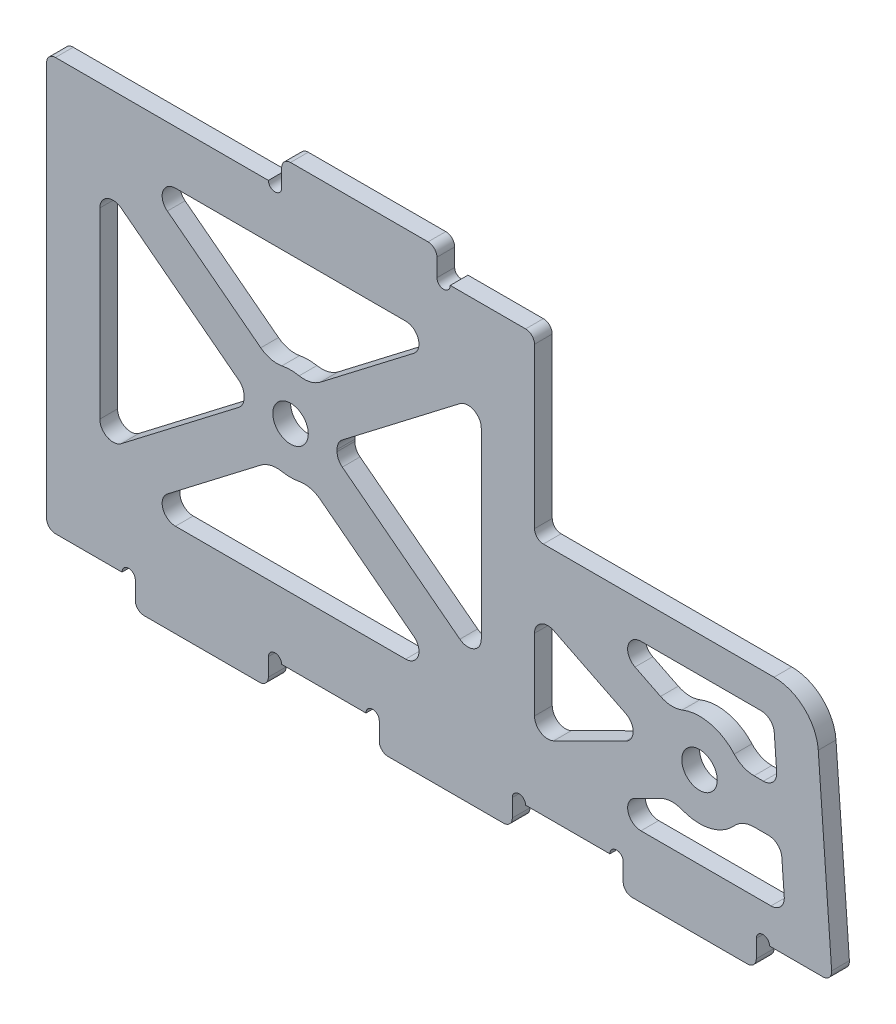
from build123d import *

# Parameters (mm, degrees)
EXTRUDE_1_DEPTH     = 2
SKETCH_2_R          = 0.75
SKETCH_2_W          = 43
SKETCH_2_H          = 33
CUT_EXTRUDE_1_DEPTH = 102.422384117
EXTRUDE_START       = -2
EXTRUDE_1_2_DEPTH   = 2
FILLET_1_R          = 1
SKETCH_4_R          = 2
CUT_EXTRUDE_2_DEPTH = 102.422384117
FILLET_2_R          = 3
FILLET_3_R          = 1.5


# Read off the part's stored shape, not the designer's step: 拉伸-薄壁1
with BuildPart() as part:
    # 草图1 → Extrude 1 (new body)
    with BuildSketch(Plane.XY):
        with BuildLine():
            Line((88.497370929, 1.072465371), (86.986854645, 21.862326856))
            ThreePointArc((86.986854645, 21.862326856), (85.405023181, 25.161395518), (82, 26.5))
            Line((82, 26.5), (55, 26.5))
            Line((55, 26.5), (55, 46.5))
            Line((55, 46.5), (44, 46.5))
            Line((44, 46.5), (44, 49.5))
            Line((44, 49.5), (26.5, 49.5))
            Line((26.5, 49.5), (26.5, 46.5))
            Line((26.5, 46.5), (0, 46.5))
            Line((0, 46.5), (0, 0))
            Line((0, 0), (10, 0))
            Line((10, 0), (10, -3))
            Line((10, -3), (25, -3))
            Line((25, -3), (25, 0))
            Line((25, 0), (37.5, 0))
            Line((37.5, 0), (37.5, -3))
            Line((37.5, -3), (52.5, -3))
            Line((52.5, -3), (52.5, 0))
            Line((52.5, 0), (65, 0))
            Line((65, 0), (65, -3))
            Line((65, -3), (80, -3))
            Line((80, -3), (80, 0))
            Line((80, 0), (87.5, 0))
            ThreePointArc((87.5, 0), (88.232279104, 0.318995364), (88.497370929, 1.072465371))
        make_face()
    extrude(amount=EXTRUDE_1_DEPTH)

    # 草图2 → 切除-拉伸1 (cut, through all)
    with BuildSketch(Plane.XY.offset(2)):
        with Locations((9.25, 0)):
            Circle(SKETCH_2_R)
        with Locations((25.75, 0)):
            Circle(SKETCH_2_R)
        with Locations((36.75, 0)):
            Circle(SKETCH_2_R)
        with Locations((53.25, 0)):
            Circle(SKETCH_2_R)
        with Locations((64.25, 0)):
            Circle(SKETCH_2_R)
        with Locations((80.75, 0)):
            Circle(SKETCH_2_R)
        with Locations((25.75, 46.5)):
            Circle(SKETCH_2_R)
        with Locations((44.75, 46.5)):
            Circle(SKETCH_2_R)
        with Locations((27.5, 24)):
            Rectangle(SKETCH_2_W, SKETCH_2_H)
        Polygon((55, 4), (83.271486825, 4), (81.92734361, 22.5), (55, 22.5), align=None)
    extrude(amount=-CUT_EXTRUDE_1_DEPTH, mode=Mode.SUBTRACT)

    # Extrude 1 2 outline → Extrude 1 2 (add)
    with BuildSketch(Plane.XY.offset(2).offset(EXTRUDE_START)):
        with BuildLine():
            Line((55, 19.707975069), (67.987198163, 13.25))
            Line((67.987198163, 13.25), (55, 6.792024931))
            Line((55, 6.792024931), (55, 4))
            Line((55, 4), (60.614853056, 4))
            Line((60.614853056, 4), (70.581480185, 8.955975008))
            ThreePointArc((70.581480185, 8.955975008), (74.80264095, 8.139120986), (78.218597547, 10.75))
            Line((78.218597547, 10.75), (82.781056192, 10.75))
            Line((82.781056192, 10.75), (82.417774242, 15.75))
            Line((82.417774242, 15.75), (78.218597547, 15.75))
            ThreePointArc((78.218597547, 15.75), (74.80264095, 18.360879014), (70.581480185, 17.544024992))
            Line((70.581480185, 17.544024992), (60.614853056, 22.5))
            Line((60.614853056, 22.5), (55, 22.5))
            Line((55, 22.5), (55, 19.707975069))
        make_face()
        with BuildLine():
            Line((22.315603781, 23.172633188), (6, 10.651355868))
            Line((6, 10.651355868), (6, 7.5))
            Line((6, 7.5), (10.106312192, 7.5))
            Line((10.106312192, 7.5), (25.359697706, 19.206086558))
            ThreePointArc((25.359697706, 19.206086558), (27.5, 18.75), (29.640302294, 19.206086558))
            Line((29.640302294, 19.206086558), (44.893687808, 7.5))
            Line((44.893687808, 7.5), (49, 7.5))
            Line((49, 7.5), (49, 10.651355868))
            Line((49, 10.651355868), (32.684396219, 23.172633188))
            ThreePointArc((32.684396219, 23.172633188), (32.75, 24), (32.684396219, 24.827366812))
            Line((32.684396219, 24.827366812), (49, 37.348644132))
            Line((49, 37.348644132), (49, 40.5))
            Line((49, 40.5), (44.893687808, 40.5))
            Line((44.893687808, 40.5), (29.640302294, 28.793913442))
            ThreePointArc((29.640302294, 28.793913442), (27.5, 29.25), (25.359697706, 28.793913442))
            Line((25.359697706, 28.793913442), (10.106312192, 40.5))
            Line((10.106312192, 40.5), (6, 40.5))
            Line((6, 40.5), (6, 37.348644132))
            Line((6, 37.348644132), (22.315603781, 24.827366812))
            ThreePointArc((22.315603781, 24.827366812), (22.25, 24), (22.315603781, 23.172633188))
        make_face()
    extrude(amount=EXTRUDE_1_2_DEPTH)

    # 圆角1
    fillet_1_edges = [part.edges().sort_by_distance(p)[0] for p in [
        (52.5, -3, 1),
        (37.5, -3, 1),
        (25, -3, 1),
        (10, -3, 1),
        (0, 0, 1),
        (0, 46.5, 1),
        (26.5, 49.5, 1),
        (44, 49.5, 1),
        (55, 46.5, 1),
        (55, 26.5, 1),
        (80, -3, 1),
        (65, -3, 1),
    ]]
    fillet(fillet_1_edges, radius=FILLET_1_R)

    # 草图4 → 切除-拉伸2 (cut, through all)
    with BuildSketch(Plane.XY.offset(2)):
        with Locations((27.5, 24)):
            Circle(SKETCH_4_R)
        with Locations((73.602051219, 13.25)):
            Circle(SKETCH_4_R)
    extrude(amount=-CUT_EXTRUDE_2_DEPTH, mode=Mode.SUBTRACT)

    # 圆角2
    fillet_2_edges = [part.edges().sort_by_distance(p)[0] for p in [
        (70.581480185, 17.544024992, 1),
        (78.218597547, 15.75, 1),
        (70.581480185, 8.955975008, 1),
        (78.218597547, 10.75, 1),
        (29.640302294, 28.793913442, 1),
        (25.359697706, 28.793913442, 1),
        (29.640302294, 19.206086558, 1),
        (25.359697706, 19.206086558, 1),
    ]]
    fillet(fillet_2_edges, radius=FILLET_2_R)

    # 圆角3
    fillet_3_edges = [part.edges().sort_by_distance(p)[0] for p in [
        (81.92734361, 22.5, 1),
        (83.271486825, 4, 1),
        (60.614853056, 4, 1),
        (82.417774242, 15.75, 1),
        (82.781056192, 10.75, 1),
        (60.614853056, 22.5, 1),
        (55, 19.707975069, 1),
        (55, 6.792024931, 1),
        (67.987198163, 13.25, 1),
        (10.106312192, 7.5, 1),
        (44.893687808, 7.5, 1),
        (49, 37.348644132, 1),
        (49, 10.651355868, 1),
        (10.106312192, 40.5, 1),
        (44.893687808, 40.5, 1),
        (6, 37.348644132, 1),
        (6, 10.651355868, 1),
        (22.315603781, 23.172633188, 1),
        (32.684396219, 23.172633188, 1),
        (32.684396219, 24.827366812, 1),
        (22.315603781, 24.827366812, 1),
    ]]
    fillet(fillet_3_edges, radius=FILLET_3_R)


solid = part.part
